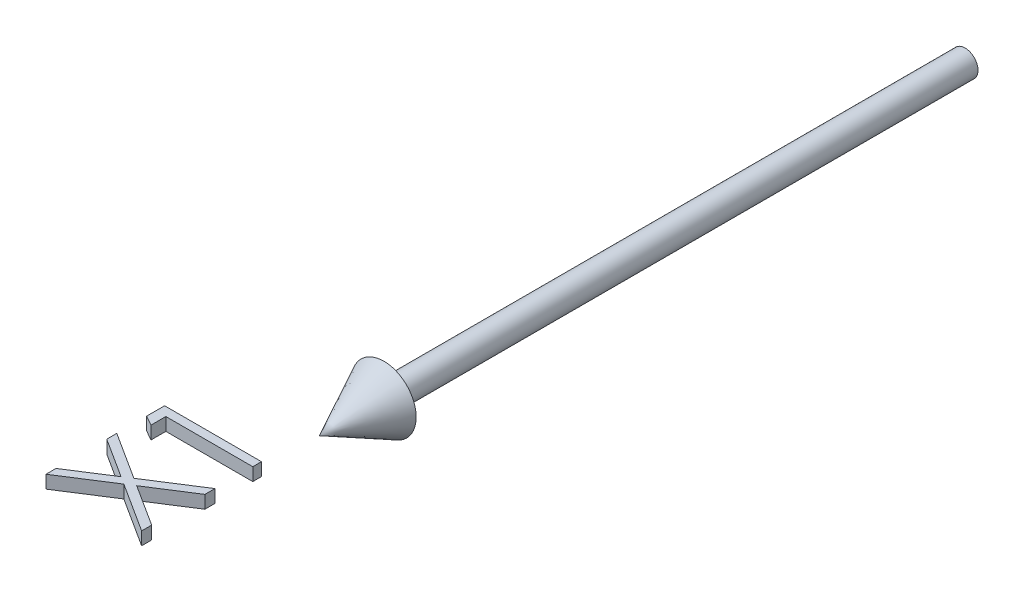
from build123d import *

# Parameters (mm, degrees)
BOSS_EXTRUDE1_DEPTH        = 1
BOSS_EXTRUDE1_DEPTH_BACK   = 1
BOSS_EXTRUDE1_2_DEPTH      = 1
BOSS_EXTRUDE1_2_DEPTH_BACK = 1


with BuildPart() as part:
    # Sketch2 → Revolve1 (revolve)
    with BuildSketch(Plane(origin=(0, 0, 0), x_dir=(1, 0, 0), z_dir=(0, 1, 0))):
        Polygon((0, -100), (5, -90), (2, -90), (2, 0), (0, 0), align=None)
    revolve(axis=Axis((0, 0, -41.949952025), (0, 0, 1)))


with BuildPart() as body_2:
    # Sketch3 → Boss-Extrude1 (new, two sides: drawn at the far end of the back side and taken through both)
    with BuildSketch(Plane(origin=(0, 0, 0), x_dir=(1, 0, 0), z_dir=(0, 1, 0)).offset(-BOSS_EXTRUDE1_DEPTH_BACK)):
        Polygon((-15, -111.726241459), (-15, -108.952803959), (0, -108.952803959), (0, -110.298957805), (-13.461538462, -110.298957805), (-13.461538462, -112.606650112), align=None)
    extrude(amount=BOSS_EXTRUDE1_DEPTH + BOSS_EXTRUDE1_DEPTH_BACK)


with BuildPart() as body_3:
    # Sketch3 → Boss-Extrude1 2 (new, two sides: drawn at the far end of the back side and taken through both)
    with BuildSketch(Plane(origin=(0, 0, 0), x_dir=(1, 0, 0), z_dir=(0, 1, 0)).offset(-BOSS_EXTRUDE1_2_DEPTH_BACK)):
        Polygon((-15, -127.318188574), (-15, -125.764702997), (-8.864182692, -121.837419343), (-15, -117.910135689), (-15, -116.356650112), (-7.650240385, -121.059174151), (0, -116.16434242), (0, -117.717827997), (-6.436298077, -121.837419343), (0, -125.957010689), (0, -127.510496266), (-7.650240385, -122.612659728), align=None)
    extrude(amount=BOSS_EXTRUDE1_2_DEPTH + BOSS_EXTRUDE1_2_DEPTH_BACK)


solid = Compound([part.part, body_2.part, body_3.part])
